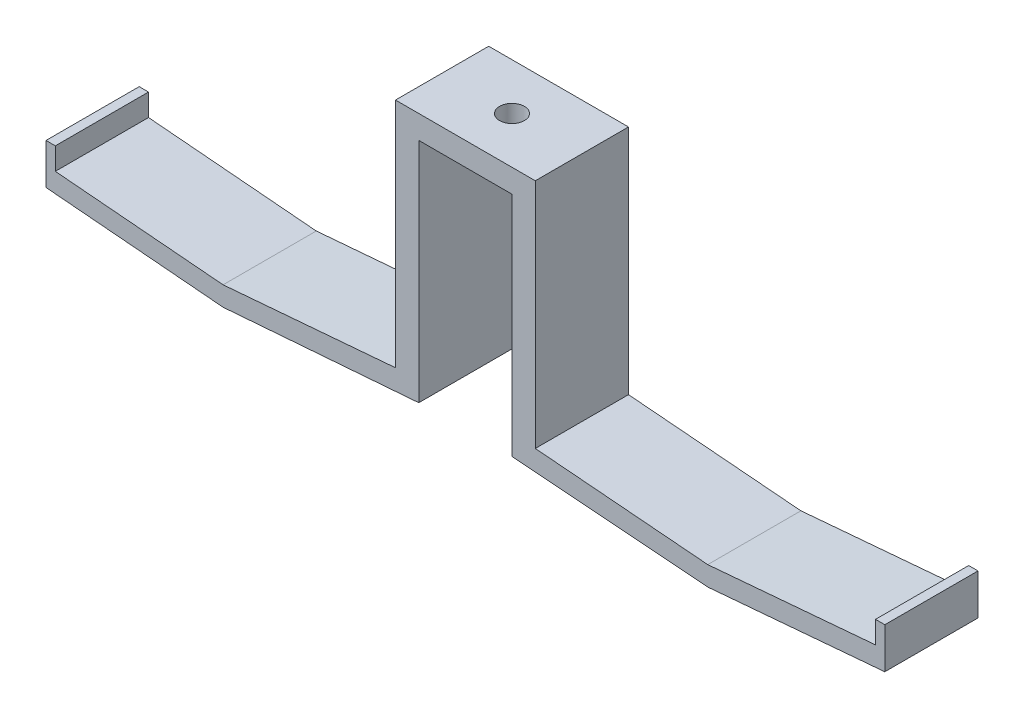
from build123d import *

# Parameters (mm, degrees)
BOSS_EXTRUDE1_DEPTH         = 25.4
F_1_4_CLEARANCE_HOLE1_D     = 6.7564
F_1_4_CLEARANCE_HOLE1_DEPTH = 50.8
F_1_4_CLEARANCE_HOLE1_TIP   = 2.029827343


with BuildPart() as part:
    # Sketch2 → Boss-Extrude1 (new body)
    with BuildSketch(Plane.XY):
        Polygon((12.7, 0), (12.7, -61.9179737), (66.04, -66.051353419), (114.3, -61.9179737), (114.3, -50.811353419), (111.76, -50.811353419), (111.76, -56.8379737), (66.04, -60.753807118), (19.05, -56.8379737), (19.05, 6.35), (-19.05, 6.35), (-19.05, -56.8379737), (-66.04, -60.753807118), (-111.76, -56.8379737), (-111.76, -50.811353419), (-114.3, -50.811353419), (-114.3, -61.9179737), (-66.04, -66.051353419), (-12.7, -61.9179737), (-12.7, 0), align=None)
    extrude(amount=BOSS_EXTRUDE1_DEPTH)

    # 1/4 Clearance Hole1
    with Locations(Plane(origin=(0, 6.35, 0), x_dir=(1, 0, 0), z_dir=(0, 1, 0))):
        with Locations((0, -12.7)):
            Hole(F_1_4_CLEARANCE_HOLE1_D / 2, depth=F_1_4_CLEARANCE_HOLE1_DEPTH)
            with Locations((0, 0, -(F_1_4_CLEARANCE_HOLE1_DEPTH + F_1_4_CLEARANCE_HOLE1_TIP / 2))):  # 118° drill point
                Cone(0, F_1_4_CLEARANCE_HOLE1_D / 2, F_1_4_CLEARANCE_HOLE1_TIP, mode=Mode.SUBTRACT)


solid = part.part
